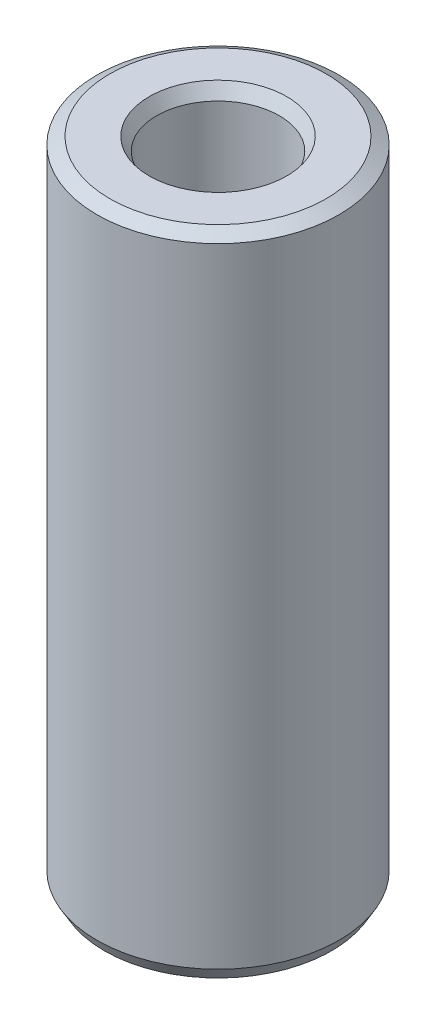
from build123d import *
from OCP.BRepFilletAPI import BRepFilletAPI_MakeChamfer

# Parameters (mm, degrees)
SKETCH1_R           = 47.5
BOSS_EXTRUDE1_DEPTH = 254.503893246
SKETCH2_R           = 24.082162837
CUT_EXTRUDE1_DEPTH  = 264.219930244
CHAMFER1_SIZE       = 2.911235666
CHAMFER1_SIZE2      = 5.042408086


with BuildPart() as part:
    # Sketch1 → Boss-Extrude1 (new body)
    with BuildSketch(Plane(origin=(0, 0, 0), x_dir=(1, 0, 0), z_dir=(0, 1, 0))):
        Circle(SKETCH1_R)
    extrude(amount=BOSS_EXTRUDE1_DEPTH)

    # Sketch2 → Cut-Extrude1 (cut, through all)
    with BuildSketch(Plane(origin=(0, 0, 0), x_dir=(1, 0, 0), z_dir=(0, 1, 0))):
        Circle(SKETCH2_R)
    extrude(amount=CUT_EXTRUDE1_DEPTH, mode=Mode.SUBTRACT)

    # Chamfer1: one chamfer whose edges measure the first distance from different faces: ONE call of the kernel's chamfer builder (chamfer() names one face for all edges)
    chamfer1_edges_1 = [part.edges().sort_by_distance(p)[0] for p in [
        (-24.082162837, 254.503893246, 0),
    ]]
    chamfer1_side_1 = [part.faces().sort_by_distance(p)[0] for p in [
        (-46.156497116, 254.503893246, 0),
    ]]
    chamfer1_edges_2 = [part.edges().sort_by_distance(p)[0] for p in [
        (-24.082162837, 0, 0),
    ]]
    chamfer1_side_2 = [part.faces().sort_by_distance(p)[0] for p in [
        (-24.082162837, 127.251946623, 0),
    ]]
    chamfer1_edges_3 = [part.edges().sort_by_distance(p)[0] for p in [
        (-47.5, 0, 0),
    ]]
    chamfer1_side_3 = [part.faces().sort_by_distance(p)[0] for p in [
        (-46.156497116, 0, 0),
    ]]
    chamfer1_edges_4 = [part.edges().sort_by_distance(p)[0] for p in [
        (-47.5, 254.503893246, 0),
    ]]
    chamfer1_side_4 = [part.faces().sort_by_distance(p)[0] for p in [
        (-47.5, 127.251946623, 0),
    ]]
    chamfer1 = BRepFilletAPI_MakeChamfer(part.part.solid().wrapped)
    for e in chamfer1_edges_1:
        chamfer1.Add(CHAMFER1_SIZE, CHAMFER1_SIZE2, e.wrapped, chamfer1_side_1[0].wrapped)  # the first distance lies on this face
    for e in chamfer1_edges_2:
        chamfer1.Add(CHAMFER1_SIZE, CHAMFER1_SIZE2, e.wrapped, chamfer1_side_2[0].wrapped)  # the first distance lies on this face
    for e in chamfer1_edges_3:
        chamfer1.Add(CHAMFER1_SIZE, CHAMFER1_SIZE2, e.wrapped, chamfer1_side_3[0].wrapped)  # the first distance lies on this face
    for e in chamfer1_edges_4:
        chamfer1.Add(CHAMFER1_SIZE, CHAMFER1_SIZE2, e.wrapped, chamfer1_side_4[0].wrapped)  # the first distance lies on this face
    add(Compound.cast(chamfer1.Shape()), mode=Mode.REPLACE)


solid = part.part
